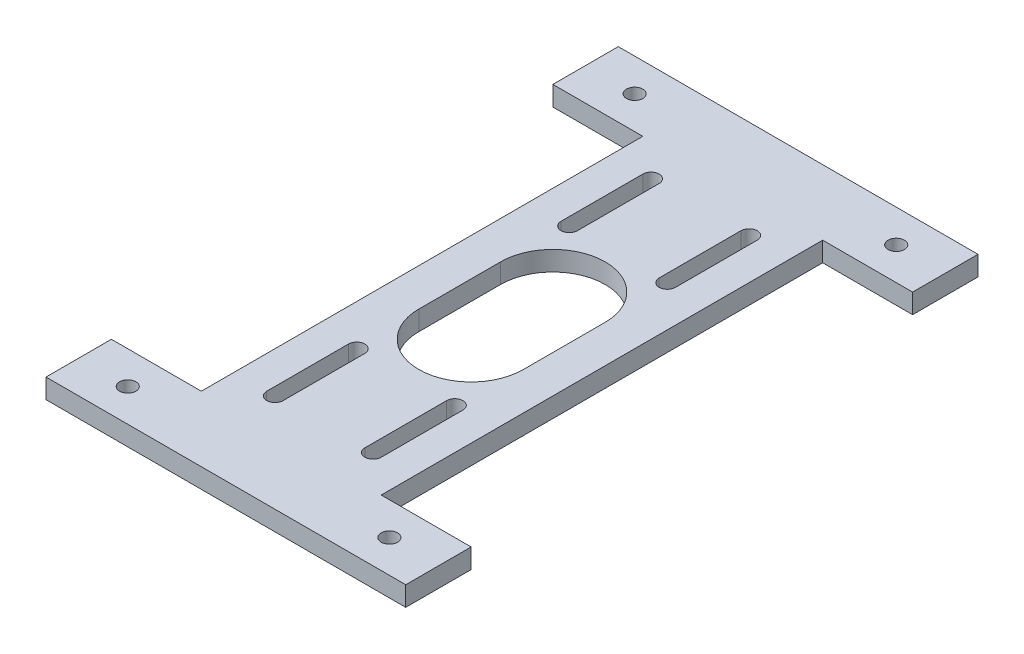
from build123d import *

# Parameters (mm, degrees)
SKETCH1_R           = 2.5
BOSS_EXTRUDE1_DEPTH = 6


with BuildPart() as part:
    # Sketch1 → Boss-Extrude1 (new body)
    with BuildSketch(Plane(origin=(0, 0, 0), x_dir=(1, 0, 0), z_dir=(0, 1, 0))):
        Polygon((-55, 67.5), (-27.5, 67.5), (-27.5, -67.5), (-55, -67.5), (-55, -87.5), (55, -87.5), (55, -67.5), (27.5, -67.5), (27.5, 67.5), (55, 67.5), (55, 87.5), (-55, 87.5), align=None)
        with Locations((-40, 77.5)):
            Circle(SKETCH1_R, mode=Mode.SUBTRACT)
        with Locations((40, 77.5)):
            Circle(SKETCH1_R, mode=Mode.SUBTRACT)
        with BuildLine():
            Line((12.5, 32.5), (12.5, 57.5))
            ThreePointArc((12.5, 57.5), (15, 60), (17.5, 57.5))
            Line((17.5, 57.5), (17.5, 32.5))
            ThreePointArc((17.5, 32.5), (15, 30), (12.5, 32.5))
        make_face(mode=Mode.SUBTRACT)
        with BuildLine():
            ThreePointArc((-17.5, -32.5), (-15, -30), (-12.5, -32.5))
            Line((-12.5, -32.5), (-12.5, -57.5))
            ThreePointArc((-12.5, -57.5), (-15, -60), (-17.5, -57.5))
            Line((-17.5, -57.5), (-17.5, -32.5))
        make_face(mode=Mode.SUBTRACT)
        with BuildLine():
            Line((12.5, -57.5), (12.5, -32.5))
            ThreePointArc((12.5, -32.5), (15, -30), (17.5, -32.5))
            Line((17.5, -32.5), (17.5, -57.5))
            ThreePointArc((17.5, -57.5), (15, -60), (12.5, -57.5))
        make_face(mode=Mode.SUBTRACT)
        with BuildLine():
            Line((-12.5, 57.5), (-12.5, 32.5))
            ThreePointArc((-12.5, 32.5), (-15, 30), (-17.5, 32.5))
            Line((-17.5, 32.5), (-17.5, 57.5))
            ThreePointArc((-17.5, 57.5), (-15, 60), (-12.5, 57.5))
        make_face(mode=Mode.SUBTRACT)
        with BuildLine():
            ThreePointArc((16, -12.5), (0, -28.5), (-16, -12.5))
            Line((-16, -12.5), (-16, 12.5))
            ThreePointArc((-16, 12.5), (0, 28.5), (16, 12.5))
            Line((16, 12.5), (16, -12.5))
        make_face(mode=Mode.SUBTRACT)
        with Locations((40, -77.5)):
            Circle(SKETCH1_R, mode=Mode.SUBTRACT)
        with Locations((-40, -77.5)):
            Circle(SKETCH1_R, mode=Mode.SUBTRACT)
    extrude(amount=BOSS_EXTRUDE1_DEPTH)


solid = part.part
